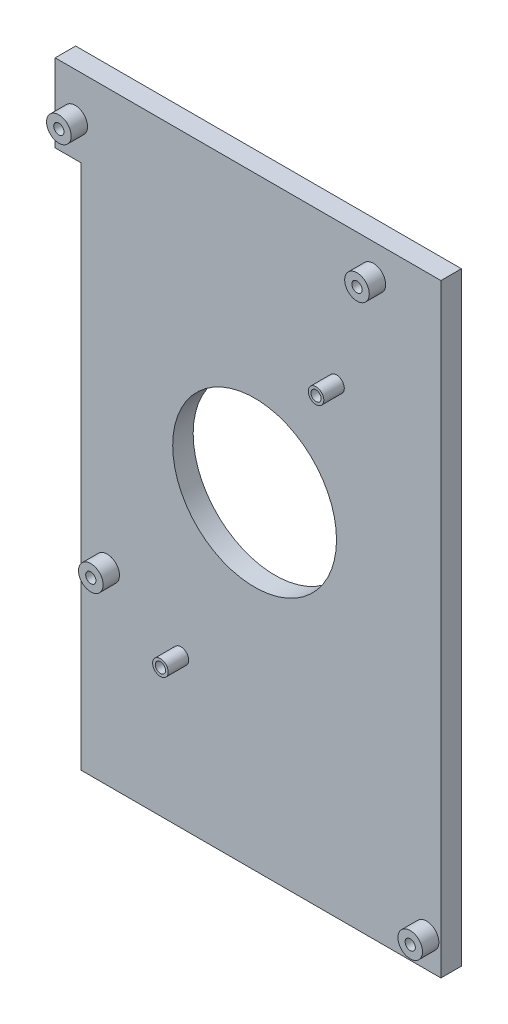
from build123d import *

# Parameters (mm, degrees)
SKETCH1_R           = 20
SKETCH1_R_2         = 1.25
BOSS_EXTRUDE1_DEPTH = 5
BOSS_EXTRUDE2_START = 4
SKETCH1_3_R         = 1.25
SKETCH1_3_R_2       = 3
BOSS_EXTRUDE2_DEPTH = 4
BOSS_EXTRUDE3_START = 5
SKETCH1_5_R         = 1.9
SKETCH1_5_R_2       = 1.25
BOSS_EXTRUDE3_DEPTH = 5
CUT_EXTRUDE1_DEPTH  = 2
INTERSECT1_START    = -101.6
INTERSECT1_DEPTH    = 170


# Read off the part's stored shape, not the designer's step: Intersect1
with BuildPart() as part:
    # Sketch1 → Boss-Extrude1 (new body)
    with BuildSketch(Plane(origin=(0, 0, 0), x_dir=(0, 1, 0), z_dir=(0, 0, 1))):
        Polygon((-101.6, 25.4), (-101.6, -81.5), (215.9, -81.5), (215.9, 12.7), (196.85, 12.7), (196.85, 6.35), (-57.15, 6.35), (-57.15, 25.4), align=None)
        with Locations(Location((148.3, -36, 0), (0, 0, 270))):
            Circle(SKETCH1_R, mode=Mode.SUBTRACT)
        with Locations(Location((-92.5, 8, 0), (0, 0, 270))):
            Circle(SKETCH1_R_2, mode=Mode.SUBTRACT)
        with Locations(Location((205.3, 7.8, 0), (0, 0, 270))):
            Circle(SKETCH1_R_2, mode=Mode.SUBTRACT)
        with Locations(Location((-86.5, -73, 0), (0, 0, 270))):
            Circle(SKETCH1_R_2, mode=Mode.SUBTRACT)
        with Locations(Location((0, 0, 0), (0, 0, 270))):
            Circle(SKETCH1_R_2, mode=Mode.SUBTRACT)
        with Locations(Location((114.3, 0, 0), (0, 0, 270))):
            Circle(SKETCH1_R_2, mode=Mode.SUBTRACT)
        with Locations(Location((104.8, -18, 0), (0, 0, 270))):
            Circle(SKETCH1_R_2, mode=Mode.SUBTRACT)
        with Locations(Location((75.7, -78, 0), (0, 0, 270))):
            Circle(SKETCH1_R_2, mode=Mode.SUBTRACT)
        with Locations(Location((181.3, -56, 0), (0, 0, 270))):
            Circle(SKETCH1_R_2, mode=Mode.SUBTRACT)
        with Locations(Location((208.3, -65, 0), (0, 0, 270))):
            Circle(SKETCH1_R_2, mode=Mode.SUBTRACT)
    extrude(amount=-BOSS_EXTRUDE1_DEPTH)

    # Sketch1<3> → Boss-Extrude2 (add)
    # profile 1 of 9: a face of its own
    with BuildSketch(Plane(origin=(0, 0, 0), x_dir=(0, 1, 0), z_dir=(0, 0, 1)).offset(BOSS_EXTRUDE2_START)):
        with BuildLine():
            Line((-95.005493963, 6.35), (-89.994506037, 6.35))
            ThreePointArc((-89.994506037, 6.35), (-89.62628447, 7.13874565), (-89.5, 8))
            ThreePointArc((-89.5, 8), (-93.36125435, 10.87371553), (-95.005493963, 6.35))
        make_face()
        with Locations(Location((-92.5, 8, 0), (0, 0, 270))):
            Circle(SKETCH1_3_R, mode=Mode.SUBTRACT)
    # profile 2 of 9: a face of its own
    with BuildSketch(Plane(origin=(0, 0, 0), x_dir=(0, 1, 0), z_dir=(0, 0, 1)).offset(BOSS_EXTRUDE2_START)):
        with BuildLine():
            ThreePointArc((-95.005493963, 6.35), (-92.5, 5), (-89.994506037, 6.35))
            Line((-89.994506037, 6.35), (-95.005493963, 6.35))
        make_face()
    # profile 3 of 9: a face of its own
    with BuildSketch(Plane(origin=(0, 0, 0), x_dir=(0, 1, 0), z_dir=(0, 0, 1)).offset(BOSS_EXTRUDE2_START)):
        with Locations(Location((-86.5, -73, 0), (0, 0, 270))):
            Circle(SKETCH1_3_R_2)
        with Locations(Location((-86.5, -73, 0), (0, 0, 270))):
            Circle(SKETCH1_3_R, mode=Mode.SUBTRACT)
    # profile 4 of 9: a face of its own
    with BuildSketch(Plane(origin=(0, 0, 0), x_dir=(0, 1, 0), z_dir=(0, 0, 1)).offset(BOSS_EXTRUDE2_START)):
        with Locations(Location((0, 0, 0), (0, 0, 270))):
            Circle(SKETCH1_3_R_2)
        with Locations(Location((0, 0, 0), (0, 0, 270))):
            Circle(SKETCH1_3_R, mode=Mode.SUBTRACT)
    # profile 5 of 9: a face of its own
    with BuildSketch(Plane(origin=(0, 0, 0), x_dir=(0, 1, 0), z_dir=(0, 0, 1)).offset(BOSS_EXTRUDE2_START)):
        with Locations(Location((75.7, -78, 0), (0, 0, 270))):
            Circle(SKETCH1_3_R_2)
        with Locations(Location((75.7, -78, 0), (0, 0, 270))):
            Circle(SKETCH1_3_R, mode=Mode.SUBTRACT)
    # profile 6 of 9: a face of its own
    with BuildSketch(Plane(origin=(0, 0, 0), x_dir=(0, 1, 0), z_dir=(0, 0, 1)).offset(BOSS_EXTRUDE2_START)):
        with Locations(Location((114.3, 0, 0), (0, 0, 270))):
            Circle(SKETCH1_3_R_2)
        with Locations(Location((114.3, 0, 0), (0, 0, 270))):
            Circle(SKETCH1_3_R, mode=Mode.SUBTRACT)
    # profile 7 of 9: a face of its own
    with BuildSketch(Plane(origin=(0, 0, 0), x_dir=(0, 1, 0), z_dir=(0, 0, 1)).offset(BOSS_EXTRUDE2_START)):
        with Locations(Location((208.3, -65, 0), (0, 0, 270))):
            Circle(SKETCH1_3_R_2)
        with Locations(Location((208.3, -65, 0), (0, 0, 270))):
            Circle(SKETCH1_3_R, mode=Mode.SUBTRACT)
    # profile 8 of 9: a face of its own
    with BuildSketch(Plane(origin=(0, 0, 0), x_dir=(0, 1, 0), z_dir=(0, 0, 1)).offset(BOSS_EXTRUDE2_START)):
        with BuildLine():
            ThreePointArc((208.3, 7.8), (204.551310342, 10.705075523), (202.673690803, 6.35))
            Line((202.673690803, 6.35), (207.926309197, 6.35))
            ThreePointArc((207.926309197, 6.35), (208.205075523, 7.051310342), (208.3, 7.8))
        make_face()
        with Locations(Location((205.3, 7.8, 0), (0, 0, 270))):
            Circle(SKETCH1_3_R, mode=Mode.SUBTRACT)
    # profile 9 of 9: a face of its own
    with BuildSketch(Plane(origin=(0, 0, 0), x_dir=(0, 1, 0), z_dir=(0, 0, 1)).offset(BOSS_EXTRUDE2_START)):
        with BuildLine():
            Line((207.926309197, 6.35), (202.673690803, 6.35))
            ThreePointArc((202.673690803, 6.35), (205.3, 4.8), (207.926309197, 6.35))
        make_face()
    extrude(amount=-BOSS_EXTRUDE2_DEPTH)

    # Sketch1<5> → Boss-Extrude3 (add)
    # profile 1 of 2: a face of its own
    with BuildSketch(Plane(origin=(0, 0, 0), x_dir=(0, 1, 0), z_dir=(0, 0, 1)).offset(BOSS_EXTRUDE3_START)):
        with Locations(Location((104.8, -18, 0), (0, 0, 270))):
            Circle(SKETCH1_5_R)
        with Locations(Location((104.8, -18, 0), (0, 0, 270))):
            Circle(SKETCH1_5_R_2, mode=Mode.SUBTRACT)
    # profile 2 of 2: a face of its own
    with BuildSketch(Plane(origin=(0, 0, 0), x_dir=(0, 1, 0), z_dir=(0, 0, 1)).offset(BOSS_EXTRUDE3_START)):
        with Locations(Location((181.3, -56, 0), (0, 0, 270))):
            Circle(SKETCH1_5_R)
        with Locations(Location((181.3, -56, 0), (0, 0, 270))):
            Circle(SKETCH1_5_R_2, mode=Mode.SUBTRACT)
    extrude(amount=-BOSS_EXTRUDE3_DEPTH)

    # Sketch3 → Cut-Extrude1 (cut)
    with BuildSketch(Plane(origin=(0, 0, -5), x_dir=(1, 0, 0), z_dir=(0, 0, -1))):
        Polygon((78, -78.067136104), (80.05, -76.883568052), (80.05, -74.516431948), (78, -73.332863896), (75.95, -74.516431948), (75.95, -76.883568052), align=None)
        Polygon((65, -210.667136104), (67.05, -209.483568052), (67.05, -207.116431948), (65, -205.932863896), (62.95, -207.116431948), (62.95, -209.483568052), align=None)
        Polygon((56, -183.667136104), (58.05, -182.483568052), (58.05, -180.116431948), (56, -178.932863896), (53.95, -180.116431948), (53.95, -182.483568052), align=None)
        Polygon((-7.8, -207.667136104), (-5.75, -206.483568052), (-5.75, -204.116431948), (-7.8, -202.932863896), (-9.85, -204.116431948), (-9.85, -206.483568052), align=None)
        Polygon((0, -116.667136104), (2.05, -115.483568052), (2.05, -113.116431948), (0, -111.932863896), (-2.05, -113.116431948), (-2.05, -115.483568052), align=None)
        Polygon((18, -107.167136104), (20.05, -105.983568052), (20.05, -103.616431948), (18, -102.432863896), (15.95, -103.616431948), (15.95, -105.983568052), align=None)
        Polygon((0, -2.367136104), (2.05, -1.183568052), (2.05, 1.183568052), (0, 2.367136104), (-2.05, 1.183568052), (-2.05, -1.183568052), align=None)
        Polygon((-8, 90.132863896), (-5.95, 91.316431948), (-5.95, 93.683568052), (-8, 94.867136104), (-10.05, 93.683568052), (-10.05, 91.316431948), align=None)
        Polygon((73, 84.132863896), (75.05, 85.316431948), (75.05, 87.683568052), (73, 88.867136104), (70.95, 87.683568052), (70.95, 85.316431948), align=None)
    extrude(amount=-CUT_EXTRUDE1_DEPTH, mode=Mode.SUBTRACT)

    # Intersect1 outline → Intersect1 (cut)
    with BuildSketch(Plane(origin=(0, 0, 0), x_dir=(1, 0, 0), z_dir=(0, 1, 0)).offset(INTERSECT1_START)):
        Polygon((83, -4), (83, 6), (75.05, 6), (75.05, 5), (-10.05, 5), (-10.05, 6), (-27, 6), (-27, -4), align=None)
    extrude(amount=INTERSECT1_DEPTH, mode=Mode.SUBTRACT)


solid = part.part
